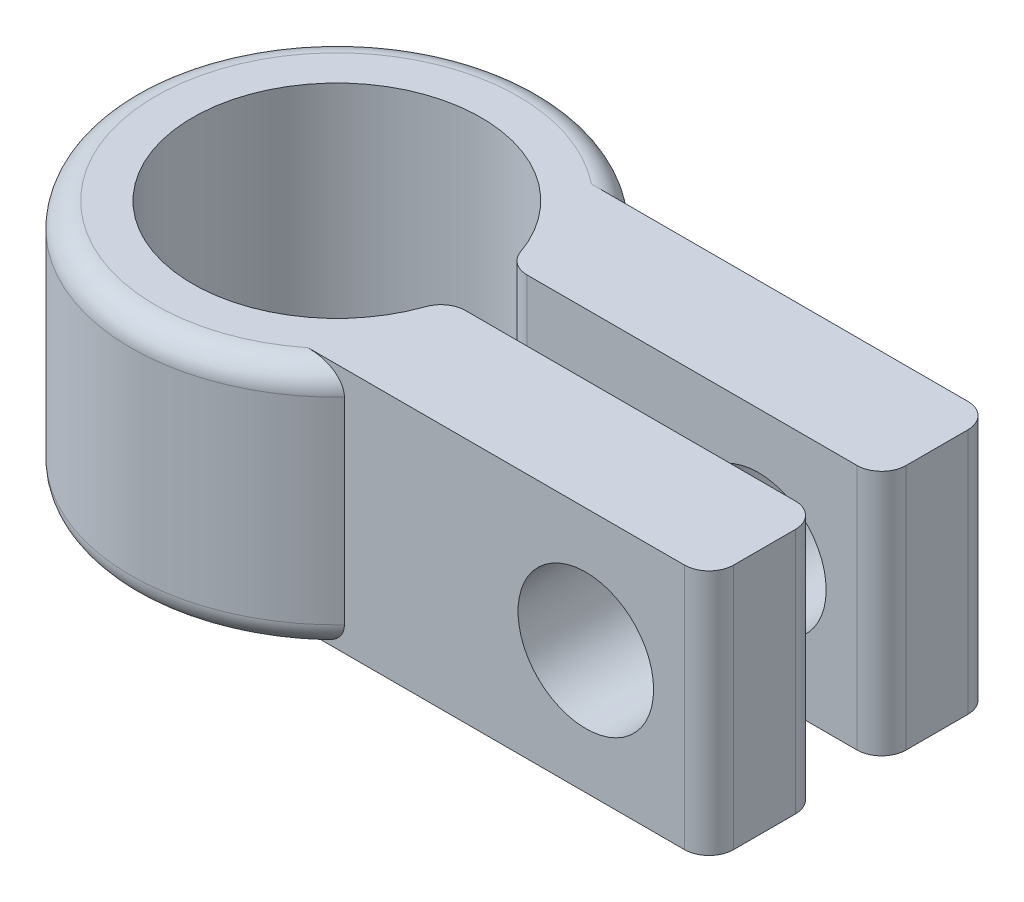
from build123d import *

# Parameters (mm, degrees)
DODANIE_WYCI_GNI_CIE1_DEPTH  = 20
ZAAWANSOWANYOTW_R1_START     = -11.5
ZAAWANSOWANYOTW_R1_OUTLINE_R = 5.5
ZAAWANSOWANYOTW_R1_DEPTH     = 23
ZAOKR_GLENIE3_R              = 2


# Read off the part's stored shape, not the designer's step: ZaawansowanyOtwór1
with BuildPart() as part:
    # Szkic1 → Dodanie-wyciągnięcie1 (new body)
    with BuildSketch(Plane(origin=(0, 0, 0), x_dir=(1, 0, 0), z_dir=(0, 1, 0))):
        with BuildLine():
            Line((12.109500403, 11.5), (39.7, 11.5))
            ThreePointArc((39.7, 11.5), (41.114213562, 10.914213562), (41.7, 9.5))
            Line((41.7, 9.5), (41.7, 4.5))
            ThreePointArc((41.7, 4.5), (41.114213562, 3.085786438), (39.7, 2.5))
            Line((39.7, 2.5), (13.774977314, 2.5))
            Line((13.774977314, 2.5), (12.939860896, 2.5))
            ThreePointArc((12.939860896, 2.5), (11.780953784, 2.869989477), (11.050830108, 3.843065693))
            ThreePointArc((11.050830108, 3.843065693), (-11.7, 0), (11.050830108, -3.843065693))
            ThreePointArc((11.050830108, -3.843065693), (11.780953784, -2.869989477), (12.939860896, -2.5))
            Line((12.939860896, -2.5), (13.774977314, -2.5))
            Line((13.774977314, -2.5), (39.7, -2.5))
            ThreePointArc((39.7, -2.5), (41.114213562, -3.085786438), (41.7, -4.5))
            Line((41.7, -4.5), (41.7, -9.5))
            ThreePointArc((41.7, -9.5), (41.114213562, -10.914213562), (39.7, -11.5))
            Line((39.7, -11.5), (12.109500403, -11.5))
            ThreePointArc((12.109500403, -11.5), (-16.7, 0), (12.109500403, 11.5))
        make_face()
    extrude(amount=DODANIE_WYCI_GNI_CIE1_DEPTH)

    # ZaawansowanyOtwór1 outline → ZaawansowanyOtwór1 (cut)
    with BuildSketch(Plane.XY.offset(ZAAWANSOWANYOTW_R1_START)):
        with Locations((31.7, 10)):
            Circle(ZAAWANSOWANYOTW_R1_OUTLINE_R)
    extrude(amount=ZAAWANSOWANYOTW_R1_DEPTH, mode=Mode.SUBTRACT)

    # Zaokrąglenie3
    zaokr_glenie3_edges = [part.edges().sort_by_distance(p)[0] for p in [
        (-16.7, 0, 0),
        (-16.7, 20, 0),
    ]]
    fillet(zaokr_glenie3_edges, radius=ZAOKR_GLENIE3_R)


solid = part.part
